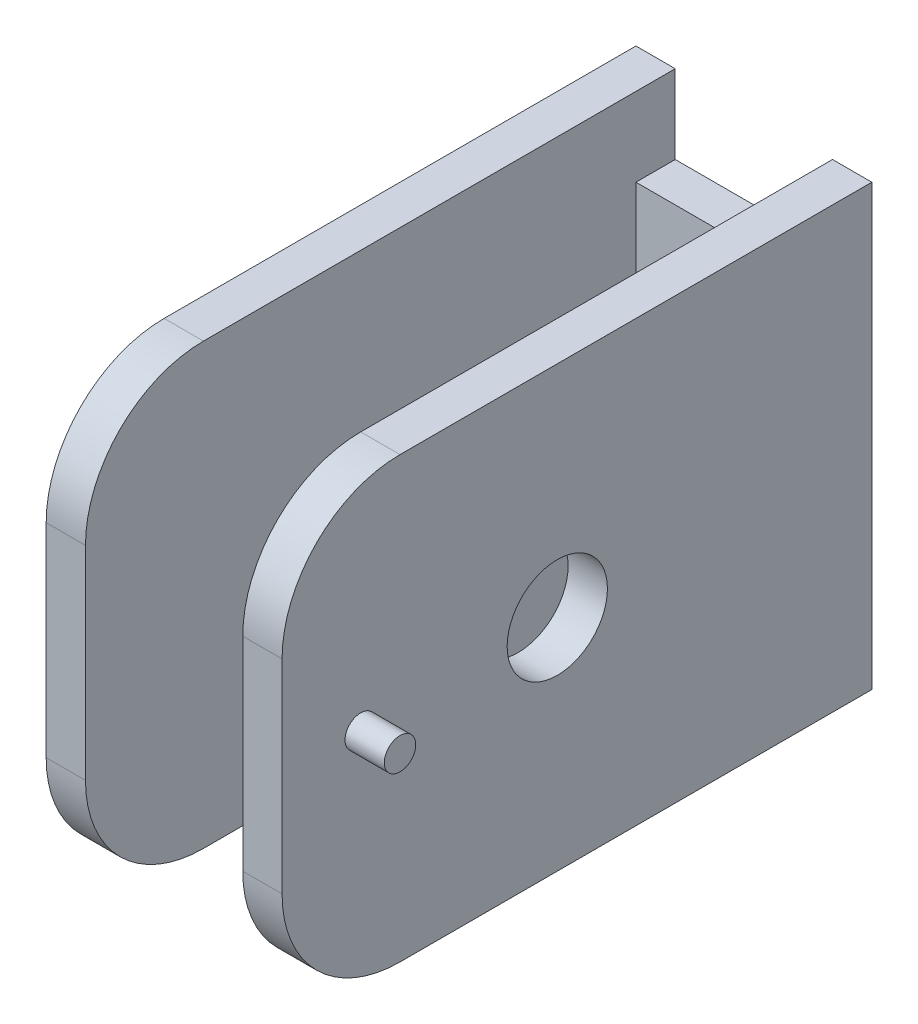
from build123d import *

# Parameters (mm, degrees)
BOSS_EXTRUDE1_DEPTH     = 13.97
SKETCH5_R               = 1
BOSS_EXTRUDE4_DEPTH     = 2.5
CUT_EXTRUDE1_REACH      = 43.248
SKETCH6_W               = 10
SKETCH6_H               = 5
FILLET1_R               = 7.5
CUT_EXTRUDE2_DEPTH      = 28.411875164
CUT_EXTRUDE2_DEPTH_BACK = 28.411875164
SKETCH4_R               = 3.1877


with BuildPart() as part:
    # Sketch1 → Boss-Extrude1 (new, symmetric)
    with BuildSketch(Plane(origin=(0, 0, 0), x_dir=(1, 0, 0), z_dir=(0, 1, 0))):
        Polygon((-7.5, -17.5), (-7.5, 20), (7.5, 20), (7.5, -17.5), (5, -17.5), (5, 17.5), (-5, 17.5), (-5, -17.5), align=None)
    extrude(amount=BOSS_EXTRUDE1_DEPTH, both=True)

    # Sketch5 → Boss-Extrude4 (add)
    with BuildSketch(Plane(origin=(7.5, 0, 0), x_dir=(0, 0, -1), z_dir=(1, 0, 0))):
        with Locations((-12.5, 0)):
            Circle(SKETCH5_R)
    boss_extrude4 = extrude(amount=BOSS_EXTRUDE4_DEPTH)

    # Sketch6 → Cut-Extrude1 (cut, up to next)
    with BuildSketch(Plane(origin=(0, 0, -20), x_dir=(-1, 0, 0), z_dir=(0, 0, -1)), mode=Mode.PRIVATE) as cut_extrude1_sk1:
        with Locations((0, -11.47)):
            Rectangle(SKETCH6_W, SKETCH6_H)
    cut_extrude1_tool1 = extrude(cut_extrude1_sk1.sketch, amount=-CUT_EXTRUDE1_REACH, mode=Mode.PRIVATE) & part.part
    cut_extrude1 = cut_extrude1_tool1.solids().sort_by_distance((0, -11.47, -20))[0]
    add(cut_extrude1, mode=Mode.SUBTRACT)

    # Fillet1
    fillet1_edges = [part.edges().sort_by_distance(p)[0] for p in [
        (-6.25, -13.97, 17.5),
        (-6.25, 13.97, 17.5),
        (6.25, -13.97, 17.5),
        (6.25, 13.97, 17.5),
    ]]
    fillet(fillet1_edges, radius=FILLET1_R)

    # Sketch4 → Cut-Extrude2 (cut, two sides: drawn at the far end of the back side and taken through both)
    with BuildSketch(Plane.ZY.offset(-5).offset(-CUT_EXTRUDE2_DEPTH_BACK)):
        Circle(SKETCH4_R)
    extrude(amount=CUT_EXTRUDE2_DEPTH + CUT_EXTRUDE2_DEPTH_BACK, mode=Mode.SUBTRACT)

    # Mirror1: Boss-Extrude4 across plane
    add(boss_extrude4.mirror(Plane(origin=(0, 0, 0), x_dir=(0, 0, 1), z_dir=(1, 0, 0))))

    # Mirror2: Cut-Extrude1 across plane
    add(cut_extrude1.mirror(Plane.ZX), mode=Mode.SUBTRACT)


solid = part.part
